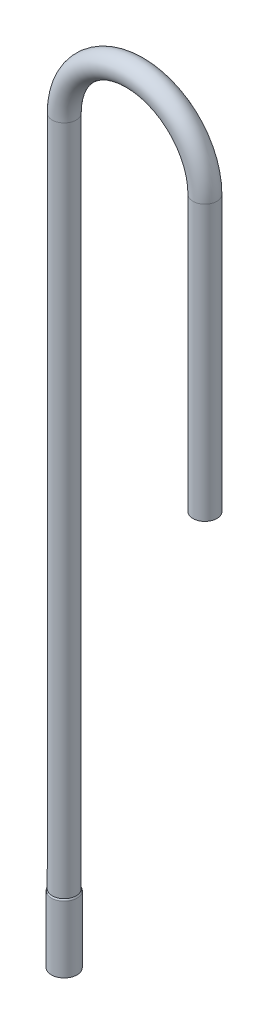
from build123d import *

# Parameters (mm, degrees)
SWEEP_THIN1_PROFILE_R   = 5.97
SWEEP_THIN1_PROFILE_R_2 = 5.57
FILLET1_R               = 1


with BuildPart() as part:
    # Sweep-Thin1: sweep along a path in Sketch1
    with BuildLine(Plane(origin=(0, 0, 0), x_dir=(0, 1, 0), z_dir=(0, 0, 1))) as sweep_thin1_path:
        Line((13.335, 0), (150, 0))
        ThreePointArc((150, 0), (185, 35), (150, 70))
        Line((150, 70), (-184.185, 70))
    # Sweep-Thin1 profile (on start of the path) → Sweep-Thin1 (sweep)
    with BuildSketch(Plane.ZX.offset(13.335)):
        Circle(SWEEP_THIN1_PROFILE_R)
        Circle(SWEEP_THIN1_PROFILE_R_2, mode=Mode.SUBTRACT)
    sweep(path=sweep_thin1_path.line)

    # Sketch19 → Revolve2 (revolve)
    with BuildSketch(Plane(origin=(0, 0, 0), x_dir=(0, 1, 0), z_dir=(0, 0, 1)), mode=Mode.PRIVATE) as revolve2_sk:
        Polygon((-184.185, 76.37), (-218.06, 76.37), (-218.06, 74.891814615), (-186.185, 74.023934498), (-186.185, 72.908200054), (-184.185, 75.57), align=None)
    revolve(revolve2_sk.sketch.rotate(Axis((-70, -184.185, 0), (0, -1, 0)), 270), axis=Axis((-70, -184.185, 0), (0, -1, 0)))

    # Fillet1
    # the kernel refuses this fillet: 1 mm, written as the material it takes off along each edge
    with BuildSketch(Plane(origin=(-70, -184.185, 0), x_dir=(0, 0, 1), z_dir=(1, 0, 0))) as fillet1_piece_1:
        with BuildLine():
            CenterArc((5.37, 0.8), FILLET1_R, 306.869897646, 53.130102354)
            Line((6.37, 0.8), (6.39, 0.8))
            Line((6.39, 0.8), (6.39, 0))
            Line((6.39, 0), (6.37, -0.02))
            ThreePointArc((6.37, -0.02), (6.17, -0.02), (5.982, -0.016))
            Line((5.982, -0.016), (5.97, 0))
        make_face()
    revolve(axis=Axis((-70, -184.185, 0), (0, -1, 0)), mode=Mode.SUBTRACT)


solid = part.part
